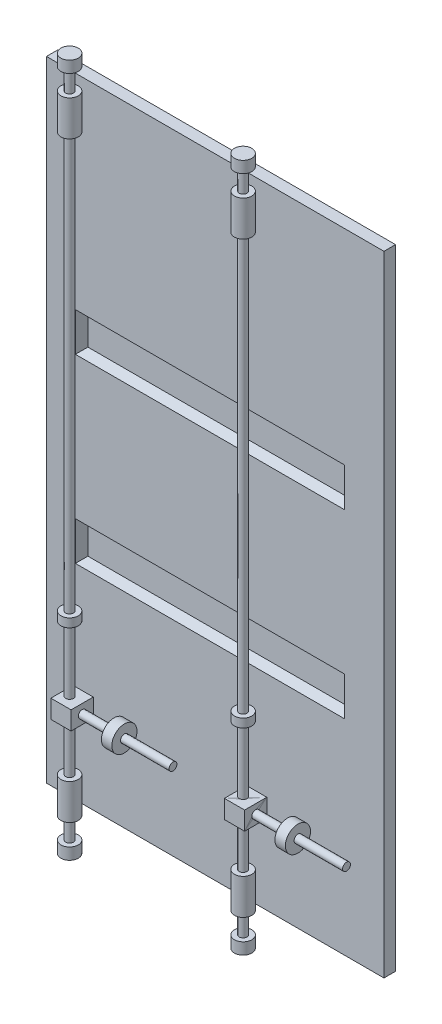
from build123d import *

# Parameters (mm, degrees)
SKETCH1_W                    = 1167
SKETCH1_H                    = 2176
BOSS_EXTRUDE1_DEPTH          = 40
SKETCH2_W                    = 931
SKETCH2_H                    = 134
CUT_EXTRUDE1_DEPTH           = 27
CUT_EXTRUDE1_DRAFT           = -31
CUT_EXTRUDE1_PROFILE_2_DEPTH = 27
CUT_EXTRUDE1_PROFILE_2_DRAFT = -31
CUT_EXTRUDE2_START           = -90
CUT_EXTRUDE2_DEPTH           = 917
BOSS_EXTRUDE2_START          = 110
SKETCH4_R                    = 13.5
BOSS_EXTRUDE2_DEPTH          = 2380
SKETCH5_R                    = 30
BOSS_EXTRUDE3_DEPTH          = 40
BOSS_EXTRUDE4_START          = -113
SKETCH6_R                    = 30
BOSS_EXTRUDE4_DEPTH          = 123
BOSS_EXTRUDE5_START          = -40
SKETCH8_W                    = 76.691760354
SKETCH8_H                    = 63.527166665
BOSS_EXTRUDE5_DEPTH          = 70
SKETCH9_R                    = 13.5
BOSS_EXTRUDE6_DEPTH          = 344
BOSS_EXTRUDE7_START          = 140
SKETCH10_R                   = 43.5
BOSS_EXTRUDE7_DEPTH          = 36
BOSS_EXTRUDE8_START          = -1670
SKETCH11_R                   = 30
BOSS_EXTRUDE8_DEPTH          = 30
LPATTERN2_COUNT              = 2
LPATTERN2_PITCH              = 600
LPATTERN3_START              = -805.424590627
LPATTERN3_OUTLINE_R          = 30
LPATTERN3_DEPTH              = 30
LPATTERN3_START_2            = 61.654119823
LPATTERN3_2_OUTLINE_W        = 70
LPATTERN3_2_OUTLINE_H        = 63.527166665
LPATTERN3_2_DEPTH            = 76.691760354
LPATTERN3_START_3            = 920.040200233
LPATTERN3_3_OUTLINE_W        = 63.527166665
LPATTERN3_3_OUTLINE_H        = 76.691760354
LPATTERN3_3_DEPTH            = 70
LPATTERN3_START_4            = 1100.040200233
LPATTERN3_4_OUTLINE_R        = 43.5
LPATTERN3_4_DEPTH            = 36
LPATTERN3_START_5            = 990.040200233
LPATTERN3_5_OUTLINE_R        = 13.5
LPATTERN3_5_DEPTH            = 314
LPATTERN3_START_6            = 658.575409373
LPATTERN3_6_OUTLINE_R        = 30
LPATTERN3_6_DEPTH            = 123
LPATTERN3_START_7            = 854.575409373
LPATTERN3_7_OUTLINE_R        = 30
LPATTERN3_7_DEPTH            = 40
SKETCH12_R                   = 30
BOSS_EXTRUDE9_DEPTH          = 40
BOSS_EXTRUDE10_START         = -113
SKETCH13_R                   = 30
BOSS_EXTRUDE10_DEPTH         = 123


# Read off the part's stored shape, not the designer's step: LPattern3
with BuildPart() as part:
    # Sketch1 → Boss-Extrude1 (new body)
    with BuildSketch(Plane.XY):
        with Locations((790.040200233, -303.424590627)):
            Rectangle(SKETCH1_W, SKETCH1_H)
    extrude(amount=BOSS_EXTRUDE1_DEPTH)


with BuildPart() as cut_extrude1_tool:
    # Sketch2 → Cut-Extrude1 (with draft: the straight prism first)
    with BuildSketch(Plane.XY.offset(40)):
        with Locations((772.040200233, 9.575409373)):
            Rectangle(SKETCH2_W, SKETCH2_H)
    extrude(amount=-CUT_EXTRUDE1_DEPTH)
    # Cut-Extrude1: the draft: its side faces are tilted about the plane it starts from
    cut_extrude1_sides = [cut_extrude1_tool.faces().sort_by_distance(p)[0] for p in [
        (306.540200233, 9.575409373, 26.5),
        (772.040200233, -57.424590627, 26.5),
        (1237.540200233, 9.575409373, 26.5),
        (772.040200233, 76.575409373, 26.5),
    ]]
    draft(cut_extrude1_sides, Plane.XY.offset(40), CUT_EXTRUDE1_DRAFT)


with BuildPart() as part_1:
    add(part.part)

    # Cut-Extrude1: cut by cut_extrude1_tool
    add(cut_extrude1_tool.part, mode=Mode.SUBTRACT)


with BuildPart() as cut_extrude1_profile_2_tool:
    # Sketch2 → Cut-Extrude1 profile 2 (with draft: the straight prism first)
    with BuildSketch(Plane.XY.offset(40)):
        with Locations((772.040200233, -616.424590627)):
            Rectangle(SKETCH2_W, SKETCH2_H)
    extrude(amount=-CUT_EXTRUDE1_PROFILE_2_DEPTH)
    # Cut-Extrude1 profile 2: the draft: its side faces are tilted about the plane it starts from
    cut_extrude1_profile_2_sides = [cut_extrude1_profile_2_tool.faces().sort_by_distance(p)[0] for p in [
        (306.540200233, -616.424590627, 26.5),
        (772.040200233, -683.424590627, 26.5),
        (1237.540200233, -616.424590627, 26.5),
        (772.040200233, -549.424590627, 26.5),
    ]]
    draft(cut_extrude1_profile_2_sides, Plane.XY.offset(40), CUT_EXTRUDE1_PROFILE_2_DRAFT)


with BuildPart() as part_2:
    add(part_1.part)

    # Cut-Extrude1 profile 2: cut by cut_extrude1_profile_2_tool
    add(cut_extrude1_profile_2_tool.part, mode=Mode.SUBTRACT)

    # Sketch3 → Cut-Extrude2 (cut)
    with BuildSketch(Plane(origin=(1373.540200233, 0, 0), x_dir=(0, 0, -1), z_dir=(1, 0, 0)).offset(CUT_EXTRUDE2_START)):
        Polygon((-30, 634.575409373), (-30, 71.566803182), (-3, 55.343566469), (-3, -36.156433531), (-30, -52.379670245), (-30, -340.424590627), (0, -340.424590627), (0, 634.575409373), align=None)
    cut_extrude2 = extrude(amount=-CUT_EXTRUDE2_DEPTH, mode=Mode.SUBTRACT)

    # Mirror1: Cut-Extrude2 across plane
    add(cut_extrude2.mirror(Plane.ZX.offset(-303.424590627)), mode=Mode.SUBTRACT)


with BuildPart() as body_2:
    # Sketch4 → Boss-Extrude2 (new body)
    with BuildSketch(Plane(origin=(0, 784.575409373, 0), x_dir=(1, 0, 0), z_dir=(0, 1, 0)).offset(BOSS_EXTRUDE2_START)):
        with Locations(Location((346.540200233, -100, 0), (0, 0, 270))):
            Circle(SKETCH4_R)
    boss_extrude2 = extrude(amount=-BOSS_EXTRUDE2_DEPTH)

    # Sketch5 → Boss-Extrude3 (add)
    with BuildSketch(Plane(origin=(0, 894.575409373, 0), x_dir=(1, 0, 0), z_dir=(0, 1, 0))):
        with Locations(Location((346.540200233, -100, 0), (0, 0, 270))):
            Circle(SKETCH5_R)
    boss_extrude3 = extrude(amount=-BOSS_EXTRUDE3_DEPTH)

    # Sketch6 → Boss-Extrude4 (add)
    with BuildSketch(Plane(origin=(0, 894.575409373, 0), x_dir=(1, 0, 0), z_dir=(0, 1, 0)).offset(BOSS_EXTRUDE4_START)):
        with Locations(Location((346.540200233, -100, 0), (0, 0, 270))):
            Circle(SKETCH6_R)
    boss_extrude4 = extrude(amount=-BOSS_EXTRUDE4_DEPTH)

    # Mirror2: Boss-Extrude3, Boss-Extrude4 across plane
    add(boss_extrude3.mirror(Plane.ZX.offset(-303.424590627)))
    add(boss_extrude4.mirror(Plane.ZX.offset(-303.424590627)))


with BuildPart() as body_3:
    # Sketch8 → Boss-Extrude5 (new body)
    with BuildSketch(Plane(origin=(360.040200233, 0, 0), x_dir=(0, 0, -1), z_dir=(1, 0, 0)).offset(BOSS_EXTRUDE5_START)):
        with Locations((-100, -1062.824787132)):
            Rectangle(SKETCH8_W, SKETCH8_H)
    extrude(amount=BOSS_EXTRUDE5_DEPTH)

    # Sketch9 → Boss-Extrude6 (add)
    with BuildSketch(Plane(origin=(360.040200233, 0, 0), x_dir=(0, 0, -1), z_dir=(1, 0, 0))):
        with Locations((-100, -1062.824787132)):
            Circle(SKETCH9_R)
    extrude(amount=BOSS_EXTRUDE6_DEPTH)

    # Sketch10 → Boss-Extrude7 (add)
    with BuildSketch(Plane(origin=(360.040200233, 0, 0), x_dir=(0, 0, -1), z_dir=(1, 0, 0)).offset(BOSS_EXTRUDE7_START)):
        with Locations((-100, -1062.824787132)):
            Circle(SKETCH10_R)
    extrude(amount=BOSS_EXTRUDE7_DEPTH)


with BuildPart() as body_4:
    # Sketch11 → Boss-Extrude8 (new body)
    with BuildSketch(Plane(origin=(0, 894.575409373, 0), x_dir=(1, 0, 0), z_dir=(0, 1, 0)).offset(BOSS_EXTRUDE8_START)):
        with Locations(Location((346.540200233, -100, 0), (0, 0, 270))):
            Circle(SKETCH11_R)
    extrude(amount=-BOSS_EXTRUDE8_DEPTH)


with BuildPart() as lpattern2_1:
    # LPattern2: Boss-Extrude2 ×2
    with Locations(*[(i * LPATTERN2_PITCH, 0, 0) for i in range(1, LPATTERN2_COUNT)]):
        add(boss_extrude2)

    # LPattern3 3 outline → LPattern3 3 (add)
    with BuildSketch(Plane.YZ.offset(LPATTERN3_START_3)):
        with Locations((-1062.824787132, 100)):
            Rectangle(LPATTERN3_3_OUTLINE_W, LPATTERN3_3_OUTLINE_H)
    extrude(amount=LPATTERN3_3_DEPTH)

    # LPattern3 4 outline → LPattern3 4 (add)
    with BuildSketch(Plane.YZ.offset(LPATTERN3_START_4)):
        with Locations((-1062.824787132, 100)):
            Circle(LPATTERN3_4_OUTLINE_R)
    extrude(amount=LPATTERN3_4_DEPTH)

    # LPattern3 5 outline → LPattern3 5 (add)
    with BuildSketch(Plane.YZ.offset(LPATTERN3_START_5)):
        with Locations((-1062.824787132, 100)):
            Circle(LPATTERN3_5_OUTLINE_R)
    extrude(amount=LPATTERN3_5_DEPTH)

    # LPattern3 6 outline → LPattern3 6 (add)
    with BuildSketch(Plane(origin=(0, 0, 0), x_dir=(1, 0, 0), z_dir=(0, 1, 0)).offset(LPATTERN3_START_6)):
        with Locations((946.540200233, -100)):
            Circle(LPATTERN3_6_OUTLINE_R)
    extrude(amount=LPATTERN3_6_DEPTH)

    # LPattern3 7 outline → LPattern3 7 (add)
    with BuildSketch(Plane(origin=(0, 0, 0), x_dir=(1, 0, 0), z_dir=(0, 1, 0)).offset(LPATTERN3_START_7)):
        with Locations((946.540200233, -100)):
            Circle(LPATTERN3_7_OUTLINE_R)
    extrude(amount=LPATTERN3_7_DEPTH)

    # Sketch12 → Boss-Extrude9 (add)
    with BuildSketch(Plane(origin=(0, -1485.424590627, 0), x_dir=(-1, 0, 0), z_dir=(0, -1, 0))):
        with Locations(Location((-946.540200233, -100, 0), (0, 0, 270))):
            Circle(SKETCH12_R)
    extrude(amount=-BOSS_EXTRUDE9_DEPTH)

    # Sketch13 → Boss-Extrude10 (add)
    with BuildSketch(Plane(origin=(0, -1485.424590627, 0), x_dir=(-1, 0, 0), z_dir=(0, -1, 0)).offset(BOSS_EXTRUDE10_START)):
        with Locations(Location((-946.540200233, -100, 0), (0, 0, 270))):
            Circle(SKETCH13_R)
    extrude(amount=-BOSS_EXTRUDE10_DEPTH)


with BuildPart() as body_6:
    # LPattern3 outline → LPattern3 (new body)
    with BuildSketch(Plane(origin=(0, 0, 0), x_dir=(1, 0, 0), z_dir=(0, 1, 0)).offset(LPATTERN3_START)):
        with Locations((946.540200233, -100)):
            Circle(LPATTERN3_OUTLINE_R)
    extrude(amount=LPATTERN3_DEPTH)


with BuildPart() as body_7:
    # LPattern3 2 outline → LPattern3 2 (new body)
    with BuildSketch(Plane.XY.offset(LPATTERN3_START_2)):
        with Locations((955.040200233, -1062.824787132)):
            Rectangle(LPATTERN3_2_OUTLINE_W, LPATTERN3_2_OUTLINE_H)
    extrude(amount=LPATTERN3_2_DEPTH)


solid = Compound([part_2.part, body_2.part, body_3.part, body_4.part, lpattern2_1.part, body_6.part, body_7.part])
